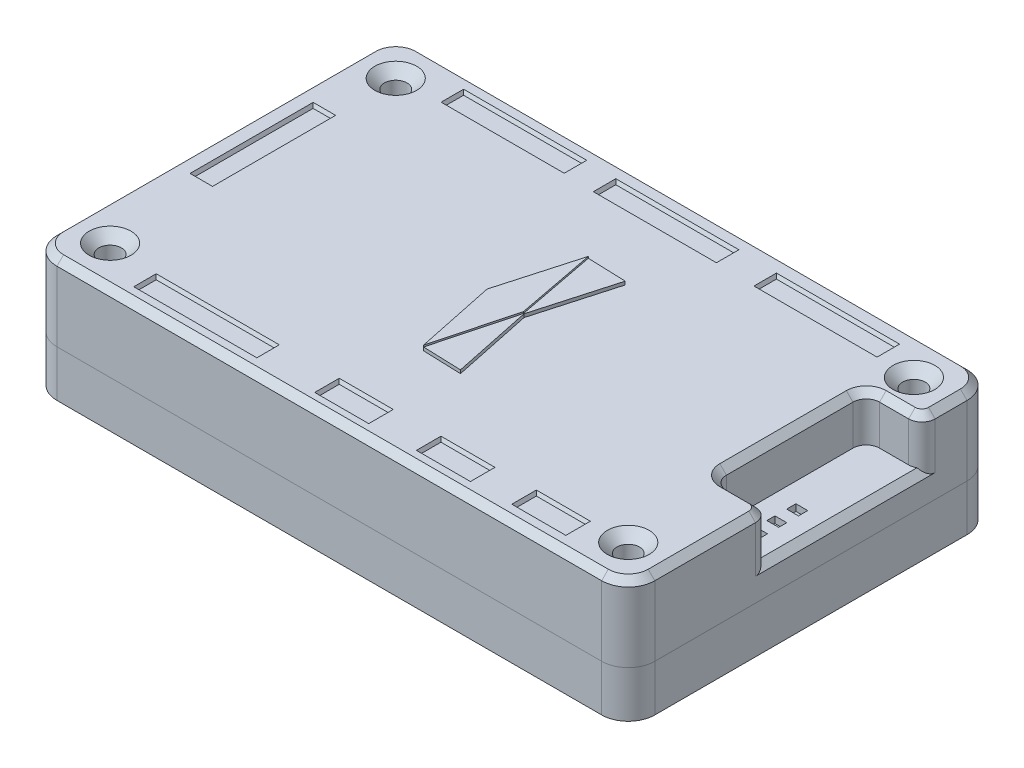
from build123d import *

# Parameters (mm, degrees)
SKETCH1_W                    = 90
SKETCH1_H                    = 54.99999999999999
BOSS_EXTRUDE1_DEPTH          = 7
CUT_EXTRUDE1_DEPTH           = 1
CUT_EXTRUDE2_DEPTH           = 5
FILLET1_R                    = 4
BOSS_EXTRUDE2_START          = 2
BOSS_EXTRUDE2_DEPTH          = 2
EXTRUDE_THIN1_DEPTH          = 2.5
BOSS_EXTRUDE3_START          = 8
BOSS_EXTRUDE3_DEPTH          = 8
BOSS_EXTRUDE4_START          = 1
BOSS_EXTRUDE4_DEPTH          = 1
SKETCH8_R                    = 1.7500000000000038
CUT_EXTRUDE3_DEPTH           = 5.4
SKETCH9_R                    = 3.0000000000000018
BOSS_EXTRUDE5_DEPTH          = 10.9
BOSS_EXTRUDE5_DRAFT          = -2.000000000000002
FILLET2_R                    = 2
CHAMFER1_SIZE                = 0.6
CHAMFER1_SIZE2               = 0.6220895731670828
SKETCH14_W                   = 8.371602811719185
SKETCH14_H                   = 23.043969682703366
CUT_EXTRUDE4_DEPTH           = 8
FILLET3_R                    = 2
EXTRUDE_THIN2_DEPTH          = 7
BOSS_EXTRUDE6_DEPTH          = 1
FILLET4_R                    = 2
CHAMFER3_SIZE                = 1
SKETCH17_W                   = 1.7794233524974743
SKETCH17_H                   = 1.3946831681736702
SKETCH17_H_2                 = 1.2190654345914376
SKETCH17_H_3                 = 1.3946831681736638
CUT_EXTRUDE5_DEPTH           = 1
SKETCH19_W                   = 8.130150853387281
SKETCH19_H                   = 3.6955231151761154
CUT_EXTRUDE6_DEPTH           = 0.5
CUT_EXTRUDE6_DRAFT           = -30.000000000000068
CUT_EXTRUDE6_PROFILE_2_DEPTH = 0.5
CUT_EXTRUDE6_PROFILE_2_DRAFT = -30.000000000000068
SKETCH19_H_2                 = 3.695523115176112
CUT_EXTRUDE6_PROFILE_3_DEPTH = 0.5
CUT_EXTRUDE6_PROFILE_3_DRAFT = -30.000000000000068
CUT_EXTRUDE6_PROFILE_4_DEPTH = 0.5
CUT_EXTRUDE6_PROFILE_4_DRAFT = -30.000000000000068
CUT_EXTRUDE6_PROFILE_5_DEPTH = 0.5
CUT_EXTRUDE6_PROFILE_5_DRAFT = -30.000000000000068
CUT_EXTRUDE6_PROFILE_6_DEPTH = 0.5
CUT_EXTRUDE6_PROFILE_6_DRAFT = -30.000000000000068
CUT_EXTRUDE6_PROFILE_7_DEPTH = 0.5
CUT_EXTRUDE6_PROFILE_7_DRAFT = -30.000000000000068
SKETCH19_W_2                 = 3.383888397202881
SKETCH19_H_3                 = 18.530408763239887
CUT_EXTRUDE6_PROFILE_8_DEPTH = 0.5
CUT_EXTRUDE6_PROFILE_8_DRAFT = -30.000000000000068
BOSS_EXTRUDE9_DEPTH          = 0.5
BOSS_EXTRUDE10_DEPTH         = 0.25
BODY_MOVE_COPY1_ANGLE        = 178.00000000002512


# Read off the part's stored shape, not the designer's step: Mirror1, Mirror2
with BuildPart() as part:
    # Sketch1 → Boss-Extrude1 (new body)
    with BuildSketch(Plane(origin=(0, 0, 0), x_dir=(1, 0, 0), z_dir=(0, 1, 0))):
        Rectangle(SKETCH1_W, SKETCH1_H)
    extrude(amount=BOSS_EXTRUDE1_DEPTH)

    # Sketch2 → Cut-Extrude1 (cut)
    with BuildSketch(Plane(origin=(0, 7, 0), x_dir=(1, 0, 0), z_dir=(0, 1, 0))):
        with BuildLine():
            Line((40.750000000000014, -25.249999999999993), (-40.75, -25.250000000000007))
            ThreePointArc((-40.75, -25.250000000000007), (-42.1642135623731, -24.664213562373096), (-42.75, -23.249999999999993))
            Line((-42.75, -23.249999999999993), (-42.75, 23.24999999999998))
            ThreePointArc((-42.75, 23.24999999999998), (-42.16421356237309, 24.66421356237309), (-40.749999999999986, 25.249999999999993))
            Line((-40.749999999999986, 25.249999999999993), (40.749999999999986, 25.249999999999993))
            ThreePointArc((40.749999999999986, 25.249999999999993), (42.1642135623731, 24.66421356237309), (42.75, 23.24999999999998))
            Line((42.75, 23.24999999999998), (42.75, -23.249999999999993))
            ThreePointArc((42.75, -23.249999999999993), (42.16421356237311, -24.66421356237309), (40.750000000000014, -25.249999999999993))
        make_face()
    extrude(amount=-CUT_EXTRUDE1_DEPTH, mode=Mode.SUBTRACT)

    # Sketch3 → Cut-Extrude2 (cut)
    with BuildSketch(Plane(origin=(0, 6, 0), x_dir=(1, 0, 0), z_dir=(0, 1, 0))):
        with BuildLine():
            Line((-38.25000000000003, 17.749999999999996), (-41.25, 17.749999999999996))
            Line((-41.25, 17.749999999999996), (-41.25, -17.749999999999993))
            Line((-41.25000000000001, -17.749999999999996), (-38.250000000000036, -17.749999999999996))
            ThreePointArc((-38.250000000000036, -17.749999999999993), (-36.128679656440376, -18.628679656440355), (-35.25000000000001, -20.750000000000014))
            Line((-35.25000000000001, -20.750000000000014), (-35.25000000000001, -23.749999999999996))
            Line((-35.25000000000001, -23.750000000000007), (35.25, -23.749999999999993))
            Line((35.25, -23.749999999999982), (35.25, -20.75))
            ThreePointArc((35.25, -20.75), (36.12867965644037, -18.62867965644035), (38.25000000000002, -17.749999999999993))
            Line((38.25000000000002, -17.749999999999996), (41.24999999999999, -17.749999999999996))
            Line((41.25000000000001, -17.749999999999996), (41.25, 17.74999999999997))
            Line((41.250000000000014, 17.749999999999975), (38.25000000000004, 17.749999999999975))
            ThreePointArc((38.25000000000004, 17.74999999999997), (36.12867965644038, 18.628679656440337), (35.250000000000014, 20.749999999999996))
            Line((35.250000000000014, 20.749999999999996), (35.250000000000014, 23.749999999999975))
            Line((35.250000000000014, 23.749999999999993), (-35.25, 23.749999999999993))
            Line((-35.25, 23.749999999999996), (-35.25, 20.750000000000014))
            ThreePointArc((-35.25, 20.750000000000014), (-36.12867965644037, 18.628679656440355), (-38.25000000000003, 17.749999999999993))
        make_face()
    extrude(amount=-CUT_EXTRUDE2_DEPTH, mode=Mode.SUBTRACT)

    # Fillet1
    fillet1_edges = [part.edges().sort_by_distance(p)[0] for p in [
        (-45, 3.5, -27.499999999999996),
        (45, 3.5, -27.499999999999996),
        (45, 3.5, 27.499999999999996),
        (-45, 3.5, 27.499999999999996),
    ]]
    fillet(fillet1_edges, radius=FILLET1_R)

    # Sketch4 → Boss-Extrude2 (add)
    with BuildSketch(Plane(origin=(0, 7, 0), x_dir=(1, 0, 0), z_dir=(0, 1, 0)).offset(BOSS_EXTRUDE2_START)):
        with BuildLine():
            Line((40.99999999999999, 26.499999999999996), (-40.999999999999964, 26.499999999999996))
            ThreePointArc((-40.999999999999964, 26.499999999999996), (-43.12132034355963, 25.621320343559645), (-44, 23.499999999999993))
            Line((-44, 23.499999999999993), (-44, -23.499999999999993))
            ThreePointArc((-44, -23.499999999999993), (-43.12132034355963, -25.62132034355965), (-40.99999999999997, -26.5))
            Line((-40.99999999999997, -26.5), (40.99999999999999, -26.499999999999996))
            ThreePointArc((40.99999999999999, -26.499999999999996), (43.12132034355964, -25.62132034355964), (44, -23.499999999999996))
            Line((44, -23.499999999999996), (44, 23.49999999999999))
            ThreePointArc((44, 23.49999999999999), (43.121320343559645, 25.621320343559642), (40.99999999999999, 26.499999999999996))
        make_face()
        with BuildLine():
            Line((-42.75, 23.24999999999998), (-42.75, -23.249999999999993))
            ThreePointArc((-42.75, -23.249999999999993), (-42.1642135623731, -24.664213562373096), (-40.75, -25.250000000000007))
            Line((-40.75, -25.250000000000007), (40.750000000000014, -25.249999999999993))
            ThreePointArc((40.750000000000014, -25.249999999999993), (42.16421356237311, -24.66421356237309), (42.75000000000001, -23.25))
            Line((42.75000000000001, -23.25), (42.75, 23.24999999999998))
            ThreePointArc((42.75, 23.24999999999998), (42.1642135623731, 24.66421356237309), (40.749999999999986, 25.249999999999993))
            Line((40.749999999999986, 25.249999999999993), (-40.749999999999986, 25.249999999999993))
            ThreePointArc((-40.749999999999986, 25.249999999999993), (-42.16421356237309, 24.66421356237309), (-42.75, 23.24999999999998))
        make_face(mode=Mode.SUBTRACT)
    extrude(amount=-BOSS_EXTRUDE2_DEPTH)

    # Sketch8 → Cut-Extrude3 (cut)
    with BuildSketch(Plane(origin=(0, 6, 0), x_dir=(1, 0, 0), z_dir=(0, 1, 0))):
        with Locations(Location((-39.00000000000001, 21.5, 0), (0, 0, 270))):
            Circle(SKETCH8_R)
    extrude(amount=-CUT_EXTRUDE3_DEPTH, mode=Mode.SUBTRACT)


with BuildPart() as body_2:
    # Sketch5 → Extrude-Thin1 (new body)
    with BuildSketch(Plane(origin=(0, 7, 0), x_dir=(1, 0, 0), z_dir=(0, 1, 0))):
        with BuildLine():
            Line((40.99999999999999, 27.499999999999996), (-40.999999999999964, 27.499999999999996))
            ThreePointArc((-40.999999999999964, 27.499999999999996), (-43.82842712474621, 26.328427124746227), (-45, 23.499999999999993))
            Line((-45, 23.499999999999993), (-45, -23.499999999999996))
            ThreePointArc((-45, -23.499999999999996), (-43.82842712474619, -26.328427124746216), (-40.999999999999964, -27.499999999999996))
            Line((-40.999999999999964, -27.499999999999996), (40.99999999999999, -27.499999999999996))
            ThreePointArc((40.99999999999999, -27.499999999999996), (43.82842712474625, -26.328427124746213), (45, -23.499999999999996))
            Line((45, -23.499999999999996), (45, 23.499999999999993))
            ThreePointArc((45, 23.499999999999993), (43.8284271247462, 26.32842712474616), (40.99999999999999, 27.499999999999996))
        make_face()
        with BuildLine():
            Line((40.99999999999999, 26.499999999999996), (-40.999999999999964, 26.499999999999996))
            ThreePointArc((-41, 26.499999999999996), (-43.121320343559674, 25.621320343559674), (-44.00000000000001, 23.500000000000014))
            Line((-44, 23.499999999999993), (-44, -23.499999999999996))
            ThreePointArc((-44, -23.500000000000004), (-43.121320343559645, -25.621320343559667), (-40.99999999999998, -26.500000000000004))
            Line((-40.999999999999964, -26.499999999999996), (40.99999999999999, -26.499999999999996))
            ThreePointArc((41.00000000000001, -26.499999999999996), (43.12132034355971, -25.62132034355966), (44.00000000000003, -23.499999999999986))
            Line((44, -23.499999999999996), (44, 23.499999999999993))
            ThreePointArc((44, 23.50000000000001), (43.12132034355966, 25.6213203435596), (41.00000000000004, 26.499999999999964))
        make_face(mode=Mode.SUBTRACT)
    extrude(amount=EXTRUDE_THIN1_DEPTH)

    # Sketch6 → Boss-Extrude3 (add)
    with BuildSketch(Plane(origin=(0, 9.5, 0), x_dir=(1, 0, 0), z_dir=(0, 1, 0)).offset(BOSS_EXTRUDE3_START)):
        with BuildLine():
            Line((40.99999999999999, 27.499999999999996), (-40.999999999999964, 27.499999999999996))
            ThreePointArc((-40.999999999999964, 27.499999999999996), (-43.82842712474618, 26.328427124746195), (-45, 23.499999999999993))
            Line((-45, 23.499999999999993), (-45, -23.499999999999996))
            ThreePointArc((-45, -23.499999999999996), (-43.82842712474619, -26.32842712474619), (-40.99999999999999, -27.499999999999996))
            Line((-40.99999999999999, -27.499999999999996), (40.99999999999999, -27.499999999999996))
            ThreePointArc((40.99999999999999, -27.499999999999996), (43.828427124746185, -26.328427124746185), (45, -23.499999999999996))
            Line((45, -23.499999999999996), (45, 23.499999999999993))
            ThreePointArc((45, 23.499999999999993), (43.82842712474619, 26.32842712474619), (40.99999999999999, 27.499999999999996))
        make_face()
        with BuildLine():
            Line((40.99999999999999, 25.5), (-40.999999999999964, 25.499999999999982))
            ThreePointArc((-40.999999999999964, 25.499999999999982), (-42.41421356237307, 24.914213562373092), (-43, 23.499999999999993))
            Line((-43, 23.499999999999993), (-42.99999999999999, -23.499999999999993))
            ThreePointArc((-42.99999999999999, -23.499999999999993), (-42.41421356237309, -24.91421356237309), (-40.99999999999999, -25.5))
            Line((-40.99999999999999, -25.5), (40.99999999999999, -25.499999999999996))
            ThreePointArc((40.99999999999999, -25.499999999999996), (42.414213562373085, -24.914213562373092), (43, -23.499999999999996))
            Line((43, -23.499999999999996), (43, 23.499999999999993))
            ThreePointArc((43, 23.499999999999993), (42.41421356237309, 24.914213562373096), (40.99999999999999, 25.5))
        make_face(mode=Mode.SUBTRACT)
    extrude(amount=-BOSS_EXTRUDE3_DEPTH)

    # Sketch7 → Boss-Extrude4 (add)
    with BuildSketch(Plane(origin=(0, 17.5, 0), x_dir=(1, 0, 0), z_dir=(0, 1, 0)).offset(BOSS_EXTRUDE4_START)):
        with BuildLine():
            Line((40.99999999999999, 27.499999999999996), (-40.999999999999964, 27.499999999999996))
            ThreePointArc((-40.999999999999964, 27.499999999999996), (-43.82842712474618, 26.328427124746195), (-45, 23.499999999999993))
            Line((-45, 23.499999999999993), (-45, -23.499999999999996))
            ThreePointArc((-45, -23.499999999999996), (-43.82842712474619, -26.32842712474619), (-40.99999999999999, -27.499999999999996))
            Line((-40.99999999999999, -27.499999999999996), (40.99999999999999, -27.499999999999996))
            ThreePointArc((40.99999999999999, -27.499999999999996), (43.828427124746185, -26.328427124746185), (45, -23.499999999999996))
            Line((45, -23.499999999999996), (45, 23.499999999999993))
            ThreePointArc((45, 23.499999999999993), (43.82842712474619, 26.32842712474619), (40.99999999999999, 27.499999999999996))
        make_face()
    extrude(amount=-BOSS_EXTRUDE4_DEPTH)


with BuildPart() as boss_extrude5_tool:
    # Sketch9 → Boss-Extrude5 (with draft: the straight prism first)
    with BuildSketch(Plane(origin=(0, 7.6, 0), x_dir=(1, 0, 0), z_dir=(0, 1, 0))):
        with Locations((-39.00000000000001, 21.5)):
            Circle(SKETCH9_R)
    extrude(amount=BOSS_EXTRUDE5_DEPTH)
    # Boss-Extrude5: the draft: its side faces are tilted about the plane it starts from
    boss_extrude5_sides = [boss_extrude5_tool.faces().sort_by_distance(p)[0] for p in [
        (-42, 13.05, -21.5),
    ]]
    draft(boss_extrude5_sides, Plane(origin=(0, 7.6, 0), x_dir=(1, 0, 0), z_dir=(0, 1, 0)), BOSS_EXTRUDE5_DRAFT)


with BuildPart() as body_2_1:
    add(body_2.part)

    # Boss-Extrude5: add boss_extrude5_tool
    add(boss_extrude5_tool.part)

    # Fillet2
    # the kernel refuses this fillet: 2 mm, written as the material it adds along each edge
    with BuildSketch(Plane(origin=(-39.00000000000001, 17.5, -21.5), x_dir=(1, 0, 0), z_dir=(0, 0, -1))) as fillet2_piece_1:
        with BuildLine():
            CenterArc((3.3457156179683025 + FILLET2_R * 0.965688774807, FILLET2_R), FILLET2_R, 181.99999999999997, 88)
            Line((3.3457156179683025 - FILLET2_R * 0.033702052212, FILLET2_R * 0.965100503297), (3.3457156179683025, 0))
            Line((3.3457156179683025, 0), (3.3457156179683025 + FILLET2_R * 0.965688774807, 0))
        make_face()
    revolve(axis=Axis((-39.00000000000001, 17.5, -21.5), (0, -1, 0)))

    # Chamfer1
    chamfer1_edges = [body_2_1.edges().sort_by_distance(p)[0] for p in [
        (-42.00000000000001, 7.6, -21.5),
    ]]
    chamfer1_side = [body_2_1.faces().sort_by_distance(p)[0] for p in [
        (-39.000000000000014, 7.6, -21.5),
    ]]
    chamfer(chamfer1_edges, length=CHAMFER1_SIZE, length2=CHAMFER1_SIZE2, reference=chamfer1_side[0])

    # Sketch13 → CSK for M3 Countersunk Flat Head Screw1 (revolve, cut)
    with BuildSketch(Plane(origin=(-39.00000000000001, 18.500000000000004, -21.5), x_dir=(0, 0, 1), z_dir=(1, 0, 0))):
        Polygon((0, 0), (-2.67e-15, 10.901000000000003), (1.6999999999999962, 10.901000000000003), (1.6999999999999984, 1.4500000000000033), (3.15, 0), align=None)
    revolve(axis=Axis((-39.00000000000001, 24.849999999999994, -21.5), (0, -1, 0)), mode=Mode.SUBTRACT)

    # Mirror1 outline → Mirror1 (revolve, cut)
    with BuildSketch(Plane(origin=(39, 0, -21.5), x_dir=(1, 0, 0), z_dir=(0, 0, 1))):
        Polygon((2.15, 17.5), (3.15, 18.5), (0, 18.5), (0, 17.5), align=None)
    revolve(axis=Axis((39, 0, -21.5), (0, 1, 0)), mode=Mode.SUBTRACT)

    # Mirror1 2 outline → Mirror1 2 (revolve)
    with BuildSketch(Plane(origin=(39, 0, -21.5), x_dir=(1, 0, 0), z_dir=(0, 0, 1))):
        with BuildLine():
            Line((1.7, 17.05), (1.7, 7.6))
            Line((1.7, 7.6), (2.377910427, 7.6))
            Line((2.377910427, 7.6), (3.020939698, 8.199634496))
            Line((3.020939698, 8.199634496), (3.278311514, 15.569798993))
            ThreePointArc((3.278311514, 15.569798993), (3.887776427, 16.938679601), (5.277093168, 17.5))
            Line((5.277093168, 17.5), (2.15, 17.5))
            Line((2.15, 17.5), (1.7, 17.05))
        make_face()
    revolve(axis=Axis((39, 0, -21.5), (0, 1, 0)))

    # Mirror2 outline → Mirror2 (revolve)
    with BuildSketch(Plane(origin=(39, 0, 21.5), x_dir=(1, 0, 0), z_dir=(0, 0, 1))):
        with BuildLine():
            Line((1.7, 17.05), (1.7, 7.6))
            Line((1.7, 7.6), (2.4, 7.6))
            Line((2.4, 7.6), (3.021710613, 8.221710613))
            Line((3.021710613, 8.221710613), (3.278311514, 15.569798993))
            ThreePointArc((3.278311514, 15.569798993), (3.887776427, 16.938679601), (5.277093168, 17.5))
            Line((5.277093168, 17.5), (2.15, 17.5))
            Line((2.15, 17.5), (1.7, 17.05))
        make_face()
    revolve(axis=Axis((39, 0, 21.5), (0, 1, 0)))

    # Mirror2 2 outline → Mirror2 2 (revolve)
    with BuildSketch(Plane(origin=(-39, 0, 21.5), x_dir=(1, 0, 0), z_dir=(0, 0, 1))):
        with BuildLine():
            Line((1.7, 17.05), (1.7, 7.6))
            Line((1.7, 7.6), (2.377910427, 7.6))
            Line((2.377910427, 7.6), (3.020939698, 8.199634496))
            Line((3.020939698, 8.199634496), (3.278311514, 15.569798993))
            ThreePointArc((3.278311514, 15.569798993), (3.887776427, 16.938679601), (5.277093168, 17.5))
            Line((5.277093168, 17.5), (2.15, 17.5))
            Line((2.15, 17.5), (1.7, 17.05))
        make_face()
    revolve(axis=Axis((-39, 0, 21.5), (0, 1, 0)))

    # Mirror2 3 outline → Mirror2 3 (revolve, cut)
    with BuildSketch(Plane(origin=(39, 0, 21.5), x_dir=(1, 0, 0), z_dir=(0, 0, 1))):
        Polygon((2.15, 17.5), (3.15, 18.5), (0, 18.5), (0, 17.5), align=None)
    revolve(axis=Axis((39, 0, 21.5), (0, 1, 0)), mode=Mode.SUBTRACT)

    # Mirror2 4 outline → Mirror2 4 (revolve, cut)
    with BuildSketch(Plane(origin=(-39, 0, 21.5), x_dir=(1, 0, 0), z_dir=(0, 0, 1))):
        Polygon((2.15, 17.5), (3.15, 18.5), (0, 18.5), (0, 17.5), align=None)
    revolve(axis=Axis((-39, 0, 21.5), (0, 1, 0)), mode=Mode.SUBTRACT)

    # Sketch14 → Cut-Extrude4 (cut)
    with BuildSketch(Plane(origin=(0, 18.500000000000004, 0), x_dir=(1, 0, 0), z_dir=(0, 1, 0))):
        with Locations((40.81419859414041, 5.176625958029023)):
            Rectangle(SKETCH14_W, SKETCH14_H)
    extrude(amount=-CUT_EXTRUDE4_DEPTH, mode=Mode.SUBTRACT)

    # Fillet3
    fillet3_edges = [body_2_1.edges().sort_by_distance(p)[0] for p in [
        (36.628397188280815, 18, 6.34535888332266),
        (36.628397188280815, 18, -16.698610799380706),
    ]]
    fillet(fillet3_edges, radius=FILLET3_R)

    # Sketch15 → Extrude-Thin2 (add)
    with BuildSketch(Plane(origin=(0, 10.500000000000002, 0), x_dir=(1, 0, 0), z_dir=(0, 1, 0))):
        with BuildLine():
            Line((45, 16.698610799380706), (38.628397188280815, 16.698610799380706))
            ThreePointArc((38.628397188280815, 16.698610799380706), (37.21418362590754, 16.11282436175392), (36.628397188280815, 14.698610799380708))
            Line((36.628397188280815, 14.698610799380708), (36.628397188280815, -4.34535888332266))
            ThreePointArc((36.628397188280815, -4.34535888332266), (37.21418362590776, -5.7595724456956825), (38.628397188280815, -6.34535888332266))
            Line((38.628397188280815, -6.34535888332266), (45, -6.34535888332266))
            Line((45, -6.34535888332266), (45, -7.34535888332266))
            Line((45, -7.34535888332266), (38.628397188280815, -7.34535888332266))
            ThreePointArc((38.628397188280836, -7.345358883322724), (36.50707684472123, -6.466679226882254), (35.628397188280815, -4.3453588833227075))
            Line((35.628397188280815, -4.34535888332266), (35.628397188280815, 14.698610799380708))
            ThreePointArc((35.62839718828093, 14.698610799380646), (36.50707684472103, 16.819931142940508), (38.62839718828099, 17.698610799380706))
            Line((38.628397188280815, 17.698610799380706), (45, 17.698610799380706))
            Line((45, 17.698610799380706), (45, 16.698610799380706))
        make_face()
    extrude(amount=EXTRUDE_THIN2_DEPTH)

    # Sketch16 → Boss-Extrude6 (add)
    with BuildSketch(Plane(origin=(0, 10.500000000000002, 0), x_dir=(1, 0, 0), z_dir=(0, 1, 0))):
        with BuildLine():
            Line((43, 16.698610799380706), (38.628397188280815, 16.698610799380706))
            ThreePointArc((38.628397188280815, 16.698610799380706), (37.21418362590772, 16.112824361753802), (36.628397188280815, 14.698610799380708))
            Line((36.628397188280815, 14.698610799380708), (36.628397188280815, -4.34535888332266))
            ThreePointArc((36.628397188280815, -4.34535888332266), (37.21418362590772, -5.759572445695755), (38.628397188280815, -6.345358883322661))
            Line((38.628397188280815, -6.345358883322661), (43, -6.34535888332266))
            Line((43, -6.34535888332266), (45, -6.34535888332266))
            Line((45, -6.34535888332266), (45, 16.698610799380706))
            Line((45, 16.698610799380706), (43, 16.698610799380706))
        make_face()
    extrude(amount=BOSS_EXTRUDE6_DEPTH)

    # Fillet4
    fillet4_edges = [body_2_1.edges().sort_by_distance(p)[0] for p in [
        (45, 15.000000000000004, -16.698610799380706),
        (45, 15.000000000000004, 6.34535888332266),
    ]]
    fillet(fillet4_edges, radius=FILLET4_R)

    # Chamfer3
    chamfer3_edges = [body_2_1.edges().sort_by_distance(p)[0] for p in [
        (40.81419859414041, 18.500000000000004, 6.34535888332266),
        (36.628397188280815, 18.500000000000004, -5.176625958029023),
        (37.21418362590772, 18.5, 5.759572445695755),
        (37.21418362590772, 18.5, -16.112824361753802),
        (45, 11.500000000000002, -5.176625958029023),
        (40.81419859414041, 18.500000000000004, -16.698610799380706),
        (45, 18.5, -21.099305399690348),
        (44.41421356237309, 18.5, 6.9311453209495655),
        (44.41421356237309, 18.5, -17.28439723700761),
        (43.82842712474619, 18.5, -26.32842712474619),
        (1.421e-14, 18.5, -27.499999999999996),
        (-43.82842712474618, 18.5, -26.328427124746195),
        (-45, 18.5, 0),
        (-43.82842712474619, 18.5, 26.32842712474619),
        (0, 18.5, 27.499999999999996),
        (43.828427124746185, 18.5, 26.328427124746185),
        (45, 18.5, 15.922679441661328),
    ]]
    chamfer(chamfer3_edges, length=CHAMFER3_SIZE)

    # Sketch17 → Cut-Extrude5 (cut)
    with BuildSketch(Plane(origin=(0, 11.500000000000004, 0), x_dir=(1, 0, 0), z_dir=(0, 1, 0))):
        with Locations((40.472309754947744, -3.5996453250948073)):
            Rectangle(SKETCH17_W, SKETCH17_H)
        with Locations((40.472309754947744, -0.6095327172957188)):
            Rectangle(SKETCH17_W, SKETCH17_H_2)
        with Locations((40.472309754947744, 2.4600125780046485)):
            Rectangle(SKETCH17_W, SKETCH17_H_3)
    extrude(amount=-CUT_EXTRUDE5_DEPTH, mode=Mode.SUBTRACT)


with BuildPart() as cut_extrude6_tool:
    # Sketch19 → Cut-Extrude6 (with draft: the straight prism first)
    with BuildSketch(Plane(origin=(0, 18.500000000000004, 0), x_dir=(1, 0, 0), z_dir=(0, 1, 0))):
        with Locations((15.121283167025476, -23.59786640115539)):
            Rectangle(SKETCH19_W, SKETCH19_H)
    extrude(amount=-CUT_EXTRUDE6_DEPTH)
    # Cut-Extrude6: the draft: its side faces are tilted about the plane it starts from
    cut_extrude6_sides = [cut_extrude6_tool.faces().sort_by_distance(p)[0] for p in [
        (19.186358594, 18.25, 23.597866401),
        (15.121283167, 18.25, 21.750104844),
        (11.05620774, 18.25, 23.597866401),
        (15.121283167, 18.25, 25.445627959),
    ]]
    draft(cut_extrude6_sides, Plane(origin=(0, 18.500000000000004, 0), x_dir=(1, 0, 0), z_dir=(0, 1, 0)), CUT_EXTRUDE6_DRAFT)


with BuildPart() as body_2_2:
    add(body_2_1.part)

    # Cut-Extrude6: cut by cut_extrude6_tool
    add(cut_extrude6_tool.part, mode=Mode.SUBTRACT)


with BuildPart() as cut_extrude6_profile_2_tool:
    # Sketch19 → Cut-Extrude6 profile 2 (with draft: the straight prism first)
    with BuildSketch(Plane(origin=(0, 18.500000000000004, 0), x_dir=(1, 0, 0), z_dir=(0, 1, 0))):
        with Locations((29.322650566773454, -23.439486839076583)):
            Rectangle(SKETCH19_W, SKETCH19_H)
    extrude(amount=-CUT_EXTRUDE6_PROFILE_2_DEPTH)
    # Cut-Extrude6 profile 2: the draft: its side faces are tilted about the plane it starts from
    cut_extrude6_profile_2_sides = [cut_extrude6_profile_2_tool.faces().sort_by_distance(p)[0] for p in [
        (33.387725993, 18.25, 23.439486839),
        (29.322650567, 18.25, 21.591725281),
        (25.25757514, 18.25, 23.439486839),
        (29.322650567, 18.25, 25.287248397),
    ]]
    draft(cut_extrude6_profile_2_sides, Plane(origin=(0, 18.500000000000004, 0), x_dir=(1, 0, 0), z_dir=(0, 1, 0)), CUT_EXTRUDE6_PROFILE_2_DRAFT)


with BuildPart() as body_2_3:
    add(body_2_2.part)

    # Cut-Extrude6 profile 2: cut by cut_extrude6_profile_2_tool
    add(cut_extrude6_profile_2_tool.part, mode=Mode.SUBTRACT)


with BuildPart() as cut_extrude6_profile_3_tool:
    # Sketch19 → Cut-Extrude6 profile 3 (with draft: the straight prism first)
    with BuildSketch(Plane(origin=(0, 18.500000000000004, 0), x_dir=(1, 0, 0), z_dir=(0, 1, 0))):
        with Locations((-0.08315479255600922, -23.70345277587461)):
            Rectangle(SKETCH19_W, SKETCH19_H_2)
    extrude(amount=-CUT_EXTRUDE6_PROFILE_3_DEPTH)
    # Cut-Extrude6 profile 3: the draft: its side faces are tilted about the plane it starts from
    cut_extrude6_profile_3_sides = [cut_extrude6_profile_3_tool.faces().sort_by_distance(p)[0] for p in [
        (3.981920634, 18.25, 23.703452776),
        (-0.083154793, 18.25, 21.855691218),
        (-4.148230219, 18.25, 23.703452776),
        (-0.083154793, 18.25, 25.551214333),
    ]]
    draft(cut_extrude6_profile_3_sides, Plane(origin=(0, 18.500000000000004, 0), x_dir=(1, 0, 0), z_dir=(0, 1, 0)), CUT_EXTRUDE6_PROFILE_3_DRAFT)


with BuildPart() as body_2_4:
    add(body_2_3.part)

    # Cut-Extrude6 profile 3: cut by cut_extrude6_profile_3_tool
    add(cut_extrude6_profile_3_tool.part, mode=Mode.SUBTRACT)


with BuildPart() as cut_extrude6_profile_4_tool:
    # Sketch19 → Cut-Extrude6 profile 4 (with draft: the straight prism first)
    with BuildSketch(Plane(origin=(0, 18.500000000000004, 0), x_dir=(1, 0, 0), z_dir=(0, 1, 0))):
        Polygon((-13.017485695672237, -25.392834771383676), (-13.017485695672237, -22.008946374180802), (-31.547894458912122, -22.008946374180805), (-31.547894458912122, -25.392834771383676), align=None)
    extrude(amount=-CUT_EXTRUDE6_PROFILE_4_DEPTH)
    # Cut-Extrude6 profile 4: the draft: its side faces are tilted about the plane it starts from
    cut_extrude6_profile_4_sides = [cut_extrude6_profile_4_tool.faces().sort_by_distance(p)[0] for p in [
        (-13.017485696, 18.25, 23.700890573),
        (-22.282690077, 18.25, 22.008946374),
        (-31.547894459, 18.25, 23.700890573),
        (-22.282690077, 18.25, 25.392834771),
    ]]
    draft(cut_extrude6_profile_4_sides, Plane(origin=(0, 18.500000000000004, 0), x_dir=(1, 0, 0), z_dir=(0, 1, 0)), CUT_EXTRUDE6_PROFILE_4_DRAFT)


with BuildPart() as body_2_5:
    add(body_2_4.part)

    # Cut-Extrude6 profile 4: cut by cut_extrude6_profile_4_tool
    add(cut_extrude6_profile_4_tool.part, mode=Mode.SUBTRACT)


with BuildPart() as cut_extrude6_profile_5_tool:
    # Sketch19 → Cut-Extrude6 profile 5 (with draft: the straight prism first)
    with BuildSketch(Plane(origin=(0, 18.500000000000004, 0), x_dir=(1, 0, 0), z_dir=(0, 1, 0))):
        Polygon((-13.941366474465921, 21.80171252505831), (-13.941366474465921, 25.185600922261187), (-32.471775237705806, 25.185600922261184), (-32.471775237705806, 21.801712525058306), align=None)
    extrude(amount=-CUT_EXTRUDE6_PROFILE_5_DEPTH)
    # Cut-Extrude6 profile 5: the draft: its side faces are tilted about the plane it starts from
    cut_extrude6_profile_5_sides = [cut_extrude6_profile_5_tool.faces().sort_by_distance(p)[0] for p in [
        (-13.941366474, 18.25, -23.493656724),
        (-23.206570856, 18.25, -25.185600922),
        (-32.471775238, 18.25, -23.493656724),
        (-23.206570856, 18.25, -21.801712525),
    ]]
    draft(cut_extrude6_profile_5_sides, Plane(origin=(0, 18.500000000000004, 0), x_dir=(1, 0, 0), z_dir=(0, 1, 0)), CUT_EXTRUDE6_PROFILE_5_DRAFT)


with BuildPart() as body_2_6:
    add(body_2_5.part)

    # Cut-Extrude6 profile 5: cut by cut_extrude6_profile_5_tool
    add(cut_extrude6_profile_5_tool.part, mode=Mode.SUBTRACT)


with BuildPart() as cut_extrude6_profile_6_tool:
    # Sketch19 → Cut-Extrude6 profile 6 (with draft: the straight prism first)
    with BuildSketch(Plane(origin=(0, 18.500000000000004, 0), x_dir=(1, 0, 0), z_dir=(0, 1, 0))):
        Polygon((9.18204958906424, 21.590539775619526), (9.18204958906424, 24.9744281728224), (-9.348359174175647, 24.974428172822396), (-9.348359174175647, 21.590539775619522), align=None)
    extrude(amount=-CUT_EXTRUDE6_PROFILE_6_DEPTH)
    # Cut-Extrude6 profile 6: the draft: its side faces are tilted about the plane it starts from
    cut_extrude6_profile_6_sides = [cut_extrude6_profile_6_tool.faces().sort_by_distance(p)[0] for p in [
        (9.182049589, 18.25, -23.282483974),
        (-0.083154793, 18.25, -24.974428173),
        (-9.348359174, 18.25, -23.282483974),
        (-0.083154793, 18.25, -21.590539776),
    ]]
    draft(cut_extrude6_profile_6_sides, Plane(origin=(0, 18.500000000000004, 0), x_dir=(1, 0, 0), z_dir=(0, 1, 0)), CUT_EXTRUDE6_PROFILE_6_DRAFT)


with BuildPart() as body_2_7:
    add(body_2_6.part)

    # Cut-Extrude6 profile 6: cut by cut_extrude6_profile_6_tool
    add(cut_extrude6_profile_6_tool.part, mode=Mode.SUBTRACT)


with BuildPart() as cut_extrude6_profile_7_tool:
    # Sketch19 → Cut-Extrude6 profile 7 (with draft: the straight prism first)
    with BuildSketch(Plane(origin=(0, 18.500000000000004, 0), x_dir=(1, 0, 0), z_dir=(0, 1, 0))):
        Polygon((33.57250214922622, 21.379367026180727), (33.57250214922622, 24.7632554233836), (15.042093385986332, 24.763255423383598), (15.042093385986332, 21.379367026180724), align=None)
    extrude(amount=-CUT_EXTRUDE6_PROFILE_7_DEPTH)
    # Cut-Extrude6 profile 7: the draft: its side faces are tilted about the plane it starts from
    cut_extrude6_profile_7_sides = [cut_extrude6_profile_7_tool.faces().sort_by_distance(p)[0] for p in [
        (33.572502149, 18.25, -23.071311225),
        (24.307297768, 18.25, -24.763255423),
        (15.042093386, 18.25, -23.071311225),
        (24.307297768, 18.25, -21.379367026),
    ]]
    draft(cut_extrude6_profile_7_sides, Plane(origin=(0, 18.500000000000004, 0), x_dir=(1, 0, 0), z_dir=(0, 1, 0)), CUT_EXTRUDE6_PROFILE_7_DRAFT)


with BuildPart() as body_2_8:
    add(body_2_7.part)

    # Cut-Extrude6 profile 7: cut by cut_extrude6_profile_7_tool
    add(cut_extrude6_profile_7_tool.part, mode=Mode.SUBTRACT)


with BuildPart() as cut_extrude6_profile_8_tool:
    # Sketch19 → Cut-Extrude6 profile 8 (with draft: the straight prism first)
    with BuildSketch(Plane(origin=(0, 18.500000000000004, 0), x_dir=(1, 0, 0), z_dir=(0, 1, 0))):
        with Locations((-40.38819113856238, 2.880479262805752)):
            Rectangle(SKETCH19_W_2, SKETCH19_H_3)
    extrude(amount=-CUT_EXTRUDE6_PROFILE_8_DEPTH)
    # Cut-Extrude6 profile 8: the draft: its side faces are tilted about the plane it starts from
    cut_extrude6_profile_8_sides = [cut_extrude6_profile_8_tool.faces().sort_by_distance(p)[0] for p in [
        (-40.388191139, 18.25, -12.145683644),
        (-42.080135337, 18.25, -2.880479263),
        (-40.388191139, 18.25, 6.384725119),
        (-38.69624694, 18.25, -2.880479263),
    ]]
    draft(cut_extrude6_profile_8_sides, Plane(origin=(0, 18.500000000000004, 0), x_dir=(1, 0, 0), z_dir=(0, 1, 0)), CUT_EXTRUDE6_PROFILE_8_DRAFT)


with BuildPart() as body_2_9:
    add(body_2_8.part)

    # Cut-Extrude6 profile 8: cut by cut_extrude6_profile_8_tool
    add(cut_extrude6_profile_8_tool.part, mode=Mode.SUBTRACT)


with BuildPart() as body_3:
    # Sketch20 → Boss-Extrude9 (new body)
    with BuildSketch(Plane(origin=(0, 18.500000000000004, 0), x_dir=(1, 0, 0), z_dir=(0, 1, 0))):
        Polygon((-3.902547034468785, -11.988380992581863), (-0.957075474676175, -7.1e-16), (1.8545110142167793, -11.98838099258186), align=None)
        Polygon((1.8545110142167767, 11.98838099258186), (-0.957075474676175, -7.1e-16), (-3.902547034468788, 11.98838099258186), align=None)
        Polygon((1.8545110142167767, 11.98838099258186), (4.79998257400939, 0), (-0.957075474676175, -7.1e-16), align=None)
        Polygon((1.8545110142167793, -11.98838099258186), (-0.957075474676175, -7.1e-16), (4.79998257400939, 0), align=None)
    extrude(amount=BOSS_EXTRUDE9_DEPTH)

    # Sketch21 → Boss-Extrude10 (add)
    with BuildSketch(Plane(origin=(0, 19.000000000000004, 0), x_dir=(1, 0, 0), z_dir=(0, 1, 0))):
        Polygon((1.8545110142167767, 11.98838099258186), (-0.8797860632038307, -1.1e-16), (1.8545110142167793, -11.98838099258186), (4.799982574009391, 2.2e-16), align=None)
    extrude(amount=BOSS_EXTRUDE10_DEPTH)


with BuildPart() as body_3_1:
    # Body-Move/Copy1: moved
    add(body_3.part.rotate(Axis((0.4487177697703013, 0, 1.65e-15), (0, 1, 0)), BODY_MOVE_COPY1_ANGLE))


solid = Compound([part.part, body_2_9.part, body_3_1.part])
